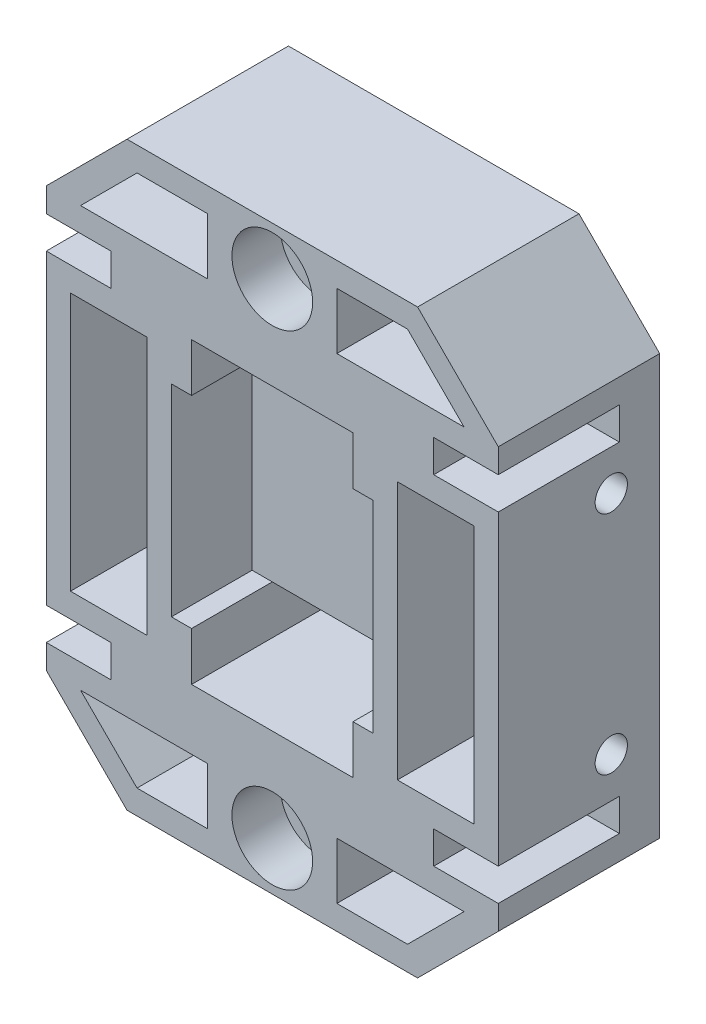
from build123d import *

# Parameters (mm, degrees)
ESBO_O1_W                = 28
ESBO_O1_H                = 36
RESSALTO_EXTRUS_O1_DEPTH = 10
ESBO_O2_W                = 12.5
ESBO_O2_H                = 12.5
CORTE_EXTRUS_O1_DEPTH    = 5
ESBO_O3_W                = 10
ESBO_O3_H                = 3
CORTE_EXTRUS_O2_DEPTH    = 25.899799196
ESBO_O4_R                = 1
CORTE_EXTRUS_O3_DEPTH    = 5
ESBO_O5_W                = 4
ESBO_O5_H                = 2
CORTE_EXTRUS_O4_DEPTH    = 7.5
ESBO_O6_R                = 2.5
CORTE_EXTRUS_O5_DEPTH    = 3
CHANFRO1_SIZE            = 5
ESBO_O7_W                = 4.75
ESBO_O7_H                = 16
CORTE_EXTRUS_O6_DEPTH    = 5
CORTE_EXTRUS_O7_DEPTH    = 8


with BuildPart() as part:
    # Esboço1 → Ressalto-extrusão1 (new body)
    with BuildSketch(Plane.XY):
        Rectangle(ESBO_O1_W, ESBO_O1_H)
    extrude(amount=RESSALTO_EXTRUS_O1_DEPTH)

    # Esboço2 → Corte-extrusão1 (cut)
    with BuildSketch(Plane.XY.offset(10)):
        Rectangle(ESBO_O2_W, ESBO_O2_H)
    extrude(amount=-CORTE_EXTRUS_O1_DEPTH, mode=Mode.SUBTRACT)

    # Esboço3 → Corte-extrusão2 (cut, through all)
    with BuildSketch(Plane.XY.offset(10)):
        with Locations((0, 7.75)):
            Rectangle(ESBO_O3_W, ESBO_O3_H)
        with Locations((0, -7.75)):
            Rectangle(ESBO_O3_W, ESBO_O3_H)
    extrude(amount=-CORTE_EXTRUS_O2_DEPTH, mode=Mode.SUBTRACT)

    # Esboço4 → Corte-extrusão3 (cut)
    with BuildSketch(Plane.ZY.offset(14)):
        with Locations((3, 7)):
            Circle(ESBO_O4_R)
        with Locations((3, -7)):
            Circle(ESBO_O4_R)
    corte_extrus_o3 = extrude(amount=-CORTE_EXTRUS_O3_DEPTH, mode=Mode.SUBTRACT)

    # Espelhar1: Corte-extrusão3 across plane
    add(corte_extrus_o3.mirror(Plane(origin=(0, 0, 0), x_dir=(0, 0, 1), z_dir=(1, 0, 0))), mode=Mode.SUBTRACT)

    # Esboço5 → Corte-extrusão4 (cut)
    with BuildSketch(Plane.XY.offset(10)):
        with Locations((-12, 10.5)):
            Rectangle(ESBO_O5_W, ESBO_O5_H)
        with Locations((12, 10.5)):
            Rectangle(ESBO_O5_W, ESBO_O5_H)
        with Locations((12, -10.5)):
            Rectangle(ESBO_O5_W, ESBO_O5_H)
        with Locations((-12, -10.5)):
            Rectangle(ESBO_O5_W, ESBO_O5_H)
    extrude(amount=-CORTE_EXTRUS_O4_DEPTH, mode=Mode.SUBTRACT)

    # Esboço6 → Corte-extrusão5 (cut)
    with BuildSketch(Plane.XY.offset(10)):
        with Locations((0, 15)):
            Circle(ESBO_O6_R)
        with Locations((0, -15)):
            Circle(ESBO_O6_R)
    extrude(amount=-CORTE_EXTRUS_O5_DEPTH, mode=Mode.SUBTRACT)

    # Chanfro1
    chanfro1_edges = [part.edges().sort_by_distance(p)[0] for p in [
        (-14, -18, 5),
        (14, -18, 5),
        (14, 18, 5),
        (-14, 18, 5),
    ]]
    chamfer(chanfro1_edges, length=CHANFRO1_SIZE)

    # Esboço7 → Corte-extrusão6 (cut)
    with BuildSketch(Plane.XY.offset(10)):
        with Locations((-10.125, 0)):
            Rectangle(ESBO_O7_W, ESBO_O7_H)
        with Locations((10.125, 0)):
            Rectangle(ESBO_O7_W, ESBO_O7_H)
    extrude(amount=-CORTE_EXTRUS_O6_DEPTH, mode=Mode.SUBTRACT)

    # Esboço8 → Corte-extrusão7 (cut)
    with BuildSketch(Plane.XY.offset(10)):
        Polygon((-11.878679656, 13), (-8.378679656, 16.5), (-4, 16.5), (-4, 13), align=None)
        Polygon((4, 13), (11.878679656, 13), (8.378679656, 16.5), (4, 16.5), align=None)
        Polygon((11.878679656, -13), (8.378679656, -16.5), (4, -16.5), (4, -13), align=None)
        Polygon((-4, -13), (-11.878679656, -13), (-8.378679656, -16.5), (-4, -16.5), align=None)
    extrude(amount=-CORTE_EXTRUS_O7_DEPTH, mode=Mode.SUBTRACT)


solid = part.part
